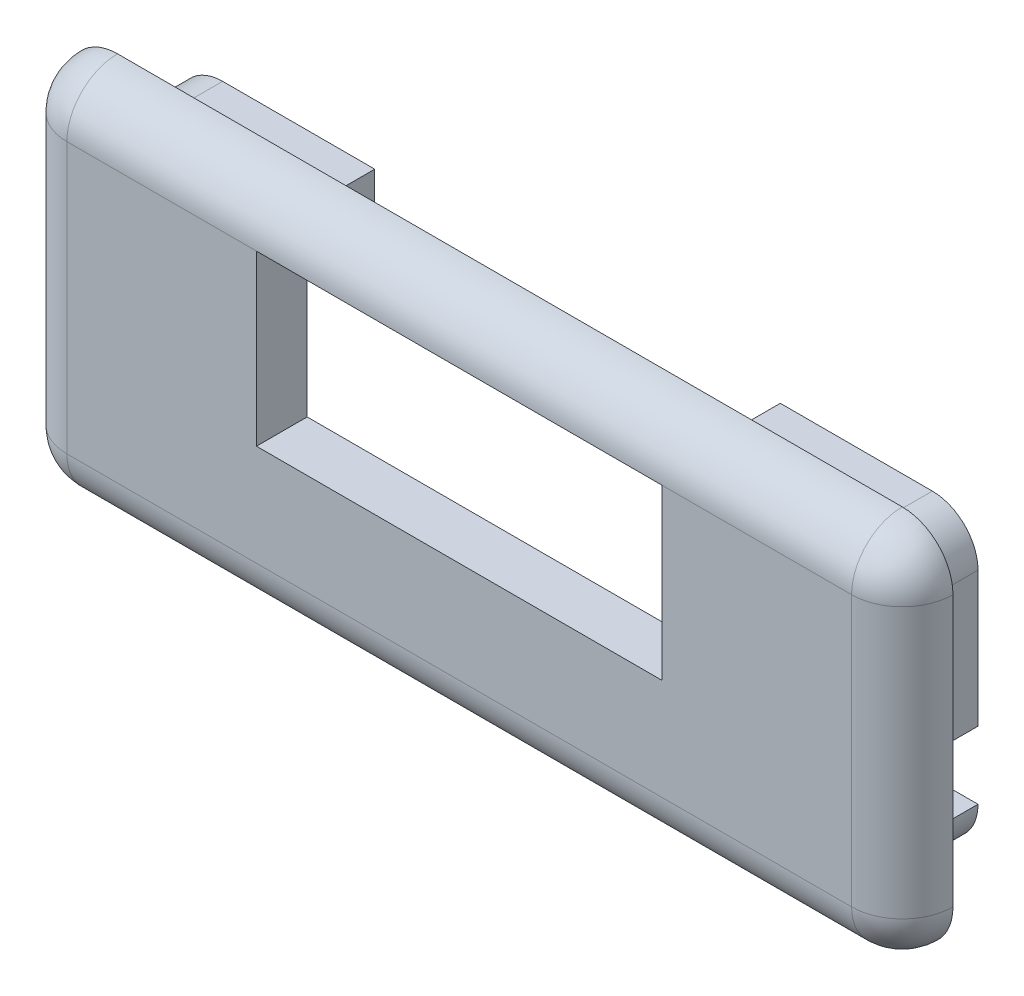
from build123d import *

# Parameters (mm, degrees)
BOSS_EXTRUDE1_DEPTH   = 2
BOSS_EXTRUDE1_2_DEPTH = 2
BOSS_EXTRUDE2_DEPTH   = 1.5
FILLET1_R             = 1.5
SKETCH4_W             = 12
SKETCH4_H             = 5
CUT_EXTRUDE1_DEPTH    = 1.5
SKETCH5_W             = 12
SKETCH5_H             = 1
CUT_EXTRUDE2_DEPTH    = 2
FILLET2_R             = 0.25


with BuildPart() as part:
    # Sketch2 → Boss-Extrude1 (new body)
    with BuildSketch(Plane.XY):
        with BuildLine():
            Line((11.85, -0.425762181), (10.85, -0.425762181))
            ThreePointArc((10.85, -0.425762181), (10.747487373, -0.673249555), (10.5, -0.775762181))
            Line((10.5, -0.775762181), (-10.5, -0.775762181))
            ThreePointArc((-10.5, -0.775762181), (-10.747487373, -0.673249555), (-10.85, -0.425762181))
            Line((-10.85, -0.425762181), (-11.85, -0.425762181))
            ThreePointArc((-11.85, -0.425762181), (-11.454594155, -1.380356336), (-10.5, -1.775762181))
            Line((-10.5, -1.775762181), (10.5, -1.775762181))
            ThreePointArc((10.5, -1.775762181), (11.454594155, -1.380356336), (11.85, -0.425762181))
        make_face()
    extrude(amount=-BOSS_EXTRUDE1_DEPTH)



with BuildPart() as body_2:
    # Sketch2 → Boss-Extrude1 2 (new body)
    with BuildSketch(Plane.XY):
        with BuildLine():
            Line((11.85, 1.574237819), (10.85, 1.574237819))
            Line((10.85, 1.574237819), (10.85, 5.574237819))
            ThreePointArc((10.85, 5.574237819), (10.747487373, 5.821725192), (10.5, 5.924237819))
            Line((10.5, 5.924237819), (-10.5, 5.924237819))
            ThreePointArc((-10.5, 5.924237819), (-10.747487373, 5.821725192), (-10.85, 5.574237819))
            Line((-10.85, 5.574237819), (-10.85, 1.574237819))
            Line((-10.85, 1.574237819), (-11.85, 1.574237819))
            Line((-11.85, 1.574237819), (-11.85, 5.574237819))
            ThreePointArc((-11.85, 5.574237819), (-11.454594155, 6.528831973), (-10.5, 6.924237819))
            Line((-10.5, 6.924237819), (10.5, 6.924237819))
            ThreePointArc((10.5, 6.924237819), (11.454594155, 6.528831973), (11.85, 5.574237819))
            Line((11.85, 5.574237819), (11.85, 1.574237819))
        make_face()
    extrude(amount=-BOSS_EXTRUDE1_2_DEPTH)


with BuildPart() as part_1:
    add(part.part)

    add(body_2.part)  # Boss-Extrude2 merges body 2
    # Sketch3 → Boss-Extrude2 (add)
    with BuildSketch(Plane.XY):
        with BuildLine():
            Line((11.6095027, 8.074237819), (-11.6095027, 8.074237819))
            ThreePointArc((-11.6095027, 8.074237819), (-12.670162872, 7.63489799), (-13.1095027, 6.574237819))
            Line((-13.1095027, 6.574237819), (-13.1095027, -1.425762181))
            ThreePointArc((-13.1095027, -1.425762181), (-12.670162872, -2.486422353), (-11.6095027, -2.925762181))
            Line((-11.6095027, -2.925762181), (11.6095027, -2.925762181))
            ThreePointArc((11.6095027, -2.925762181), (12.670162872, -2.486422353), (13.1095027, -1.425762181))
            Line((13.1095027, -1.425762181), (13.1095027, 6.574237819))
            ThreePointArc((13.1095027, 6.574237819), (12.670162872, 7.63489799), (11.6095027, 8.074237819))
        make_face()
    extrude(amount=BOSS_EXTRUDE2_DEPTH)

    # Fillet1
    fillet1_edges = [part_1.edges().sort_by_distance(p)[0] for p in [
        (12.670162872, 7.63489799, 1.5),
        (13.1095027, 2.574237819, 1.5),
        (12.670162872, -2.486422353, 1.5),
        (0, -2.925762181, 1.5),
        (-12.670162872, -2.486422353, 1.5),
        (-13.1095027, 2.574237819, 1.5),
        (-12.670162872, 7.63489799, 1.5),
        (0, 8.074237819, 1.5),
    ]]
    fillet(fillet1_edges, radius=FILLET1_R - 0.0001)  # a hair under: the kernel refuses the full size

    # Sketch4 → Cut-Extrude1 (cut)
    with BuildSketch(Plane.XY.offset(1.5)):
        with Locations((0, 4.074237819)):
            Rectangle(SKETCH4_W, SKETCH4_H)
    extrude(amount=-CUT_EXTRUDE1_DEPTH, mode=Mode.SUBTRACT)

    # Sketch5 → Cut-Extrude2 (cut)
    with BuildSketch(Plane(origin=(0, 0, -2), x_dir=(-1, 0, 0), z_dir=(0, 0, -1))):
        with Locations((0, 6.424237819)):
            Rectangle(SKETCH5_W, SKETCH5_H)
    extrude(amount=-CUT_EXTRUDE2_DEPTH, mode=Mode.SUBTRACT)

    # Fillet2
    fillet2_edges = [part_1.edges().sort_by_distance(p)[0] for p in [
        (0, -0.775762181, 0),
        (10.747487373, -0.673249555, 0),
        (10.747487373, 5.821725192, 0),
        (10.85, 3.574237819, 0),
        (-10.85, 3.574237819, 0),
        (-10.747487373, 5.821725192, 0),
        (-8.25, 5.924237819, 0),
        (8.25, 5.924237819, 0),
        (-10.747487373, -0.673249555, 0),
    ]]
    fillet(fillet2_edges, radius=FILLET2_R)


solid = part_1.part
